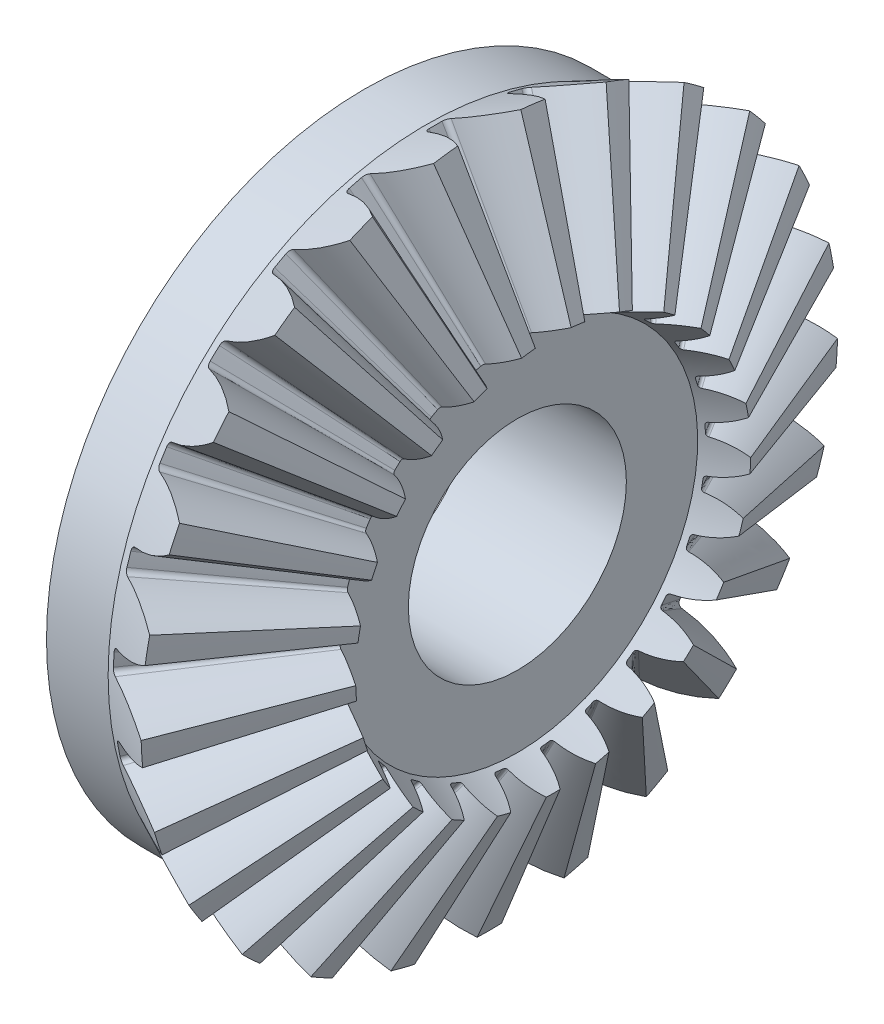
from build123d import *

# Parameters (mm, degrees)
TEETHCUTS_COUNT = 25
TEETHCUTS_ANGLE = 345.6
HUBSKE_R        = 23.331263511
HUB_DEPTH       = 4.523567249
BORSKE_R        = 8
BORE_DEPTH      = 20.0000508


with BuildPart() as part:
    # BasProSke → Base-Revolve (revolve)
    with BuildSketch(Plane(origin=(0, 0, 0), x_dir=(1, 0, 0), z_dir=(0, 1, 0)), mode=Mode.PRIVATE) as base_revolve_sk:
        Polygon((0, 0), (0, 23.331263516), (4.641273296, 25.55907469), (9.330027367, 14.498869006), (6.69717722, 13.23510094), (6.69717722, 0), align=None)
    revolve(base_revolve_sk.sketch.rotate(Axis((-10, 0, 0), (1, 0, 0)), 180), axis=Axis((-10, 0, 0), (1, 0, 0)))

    # ToothCut: read off the stored shape, not the designer's step
    # ToothCut: loft between two sections, ruled curve by curve
    toothcut_from = [
        Edge.make_bspline([(15.485238682, 0.004178078, -0.008250312), (15.479699714, 0.001519373, -0.015440524), (15.471200427, -0.002560285, -0.014687839), (15.466760104, -0.004691639, -0.006613875)], [0, 0, 0, 0, 1, 1, 1, 1], 3, [1, 0.72471089, 0.72471089, 1]),
        Edge.make_bspline([(15.466760104, -0.004691639, 0.006613875), (15.471200427, -0.002560285, 0.014687839), (15.479699714, 0.001519373, 0.015440524), (15.485238682, 0.004178078, 0.008250312)], [0, 0, 0, 0, 1, 1, 1, 1], 3, [1, 0.72471089, 0.72471089, 1]),
        Edge.make_bspline([(15.466760104, -0.004691639, -0.006613875), (15.466198007, -0.004961446, -0.005591798), (15.465770918, -0.005166449, -0.004492271), (15.465487306, -0.005302583, -0.003337099)], [0, 0, 0, 0, 1, 1, 1, 1], 3, [1, 0.993389772, 0.993389772, 1]),
        Edge.make_bspline([(15.465487306, -0.005302583, 0.003337099), (15.465770918, -0.005166449, 0.004492271), (15.466198007, -0.004961446, 0.005591798), (15.466760104, -0.004691639, 0.006613875)], [0, 0, 0, 0, 1, 1, 1, 1], 3, [1, 0.993389772, 0.993389772, 1]),
        Edge.make_bspline([(15.465487306, -0.005302583, -0.003337099), (15.464947652, -0.005561617, -0.00113905), (15.464947652, -0.005561617, 0.00113905), (15.465487306, -0.005302583, 0.003337099)], [0, 0, 0, 0, 1, 1, 1, 1], 3, [1, 0.976573485, 0.976573485, 1]),
        Edge.make_line((15.485238682, 0.004178078, 0.008250312), (15.485238682, 0.004178078, -0.008250312)),
    ]
    toothcut_to = [
        Edge.make_bspline([(5.000050597, 25.731287794, -2.615742634), (3.804495635, 25.157421415, -1.670162832), (2.439533055, 24.502239378, -1.069822011), (0.984659471, 23.80390006, -0.849684546)], [0, 0, 0, 0, 1, 1, 1, 1], 3, [1, 0.980586375, 0.980586375, 1]),
        Edge.make_bspline([(0.984659471, 23.80390006, 0.849684546), (2.439533055, 24.502239378, 1.069822011), (3.804495635, 25.157421415, 1.670162832), (5.000050597, 25.731287794, 2.615742634)], [0, 0, 0, 0, 1, 1, 1, 1], 3, [1, 0.980586375, 0.980586375, 1]),
        Edge.make_bspline([(0.984659471, 23.80390006, -0.849684546), (0.804814372, 23.717574413, -0.822472117), (0.686922602, 23.660986364, -0.6693832), (0.690799567, 23.662847307, -0.468091374)], [0, 0, 0, 0, 1, 1, 1, 1], 3, [1, 0.830874805, 0.830874805, 1]),
        Edge.make_bspline([(0.690799567, 23.662847307, 0.468091374), (0.686922602, 23.660986364, 0.6693832), (0.804814372, 23.717574413, 0.822472117), (0.984659471, 23.80390006, 0.849684546)], [0, 0, 0, 0, 1, 1, 1, 1], 3, [1, 0.830874805, 0.830874805, 1]),
        Edge.make_bspline([(0.690799567, 23.662847307, -0.468091374), (0.696809534, 23.665732091, -0.156054193), (0.696809534, 23.665732091, 0.156054193), (0.690799567, 23.662847307, 0.468091374)], [0, 0, 0, 0, 1, 1, 1, 1], 3, [1, 0.999847907, 0.999847907, 1]),
        Edge.make_line((5.000050597, 25.731287794, 2.615742634), (5.000050597, 25.731287794, -2.615742634)),
    ]
    toothcut = Solid(Shell([*[Face.make_surface_from_curves(toothcut_from[k], toothcut_to[k]) for k in range(6)], Face(Wire(toothcut_from)), Face(Wire(toothcut_to))]))
    add(toothcut, mode=Mode.SUBTRACT)

    # TeethCuts: ToothCut ×25 about axis
    teethcuts_axis = Axis((-10, 0, 0), (1, 0, 0))
    for i in range(1, TEETHCUTS_COUNT):
        add(toothcut.rotate(teethcuts_axis, i * TEETHCUTS_ANGLE / (TEETHCUTS_COUNT - 1)), mode=Mode.SUBTRACT)

    # HubSke → Hub (add)
    with BuildSketch(Plane.ZY):
        Circle(HUBSKE_R)
    extrude(amount=HUB_DEPTH)

    # BorSke → Bore (cut, symmetric)
    with BuildSketch(Plane(origin=(0, 0, 0), x_dir=(0, 0, -1), z_dir=(1, 0, 0))):
        with Locations(Location((0, 0, 0), (0, 0, 180))):
            Circle(BORSKE_R)
    extrude(amount=BORE_DEPTH, both=True, mode=Mode.SUBTRACT)


solid = part.part
